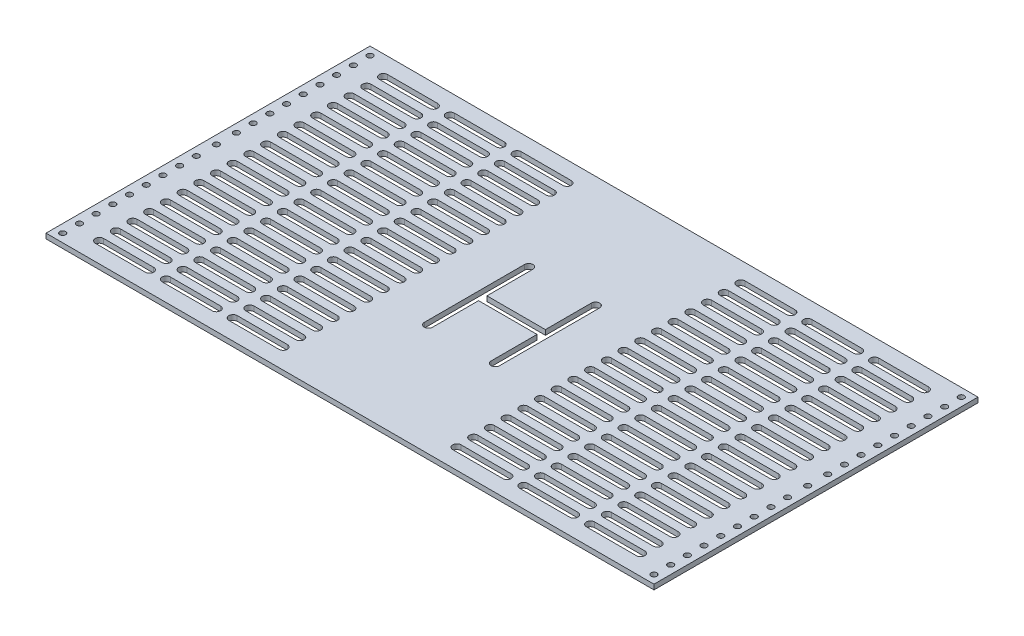
from build123d import *

# Parameters (mm, degrees)
EXTRUDE_1_DEPTH          = 3
CUT_EXTRUDE_1_DEPTH      = 267.024434968
CUT_EXTRUDE_1_DEPTH_BACK = 267.024434968
CUT_EXTRUDE_2_DEPTH      = 267.024434968
MIRROR_2_COPY_1_DEPTH    = 267.024434968
MIRROR_2_COPY_2_DEPTH    = 267.024434968
SKETCH_4_R               = 1.75
CUT_EXTRUDE_3_DEPTH      = 267.024434968
SKETCH_5_R               = 1.75
CUT_EXTRUDE_4_DEPTH      = 267.024434968
MIRROR_4_COPY_1_SKETCH_R = 1.75
MIRROR_4_COPY_1_DEPTH    = 267.024434968


with BuildPart() as part:
    # 草图1 → 凸台-拉伸1 (new body)
    with BuildSketch(Plane(origin=(0, 0, 0), x_dir=(1, 0, 0), z_dir=(0, 1, 0))):
        Polygon((0, 0), (-182, 0), (-182, -194), (182, -194), (182, 0), align=None)
    extrude(amount=EXTRUDE_1_DEPTH)

    # 草图2 → 切除-拉伸1 (cut, two sides: drawn at the far end of the back side and taken through both)
    with BuildSketch(Plane(origin=(0, 3, 0), x_dir=(1, 0, 0), z_dir=(0, 1, 0)).offset(-CUT_EXTRUDE_1_DEPTH_BACK)):
        with BuildLine():
            Line((17.5, -94.5), (-17.5, -94.5))
            Line((-17.5, -94.5), (-17.5, -67))
            ThreePointArc((-17.5, -67), (-20, -64.5), (-22.5, -67))
            Line((-22.5, -67), (-22.5, -127))
            ThreePointArc((-22.5, -127), (-20, -129.5), (-17.5, -127))
            Line((-17.5, -127), (-17.5, -99.5))
            Line((-17.5, -99.5), (17.5, -99.5))
            Line((17.5, -99.5), (17.5, -127))
            ThreePointArc((17.5, -127), (20, -129.5), (22.5, -127))
            Line((22.5, -127), (22.5, -67))
            ThreePointArc((22.5, -67), (20, -64.5), (17.5, -67))
            Line((17.5, -67), (17.5, -94.5))
        make_face()
    extrude(amount=CUT_EXTRUDE_1_DEPTH + CUT_EXTRUDE_1_DEPTH_BACK, mode=Mode.SUBTRACT)

    # 草图3 → 切除-拉伸2 (cut, through all)
    with BuildSketch(Plane(origin=(0, 3, 0), x_dir=(1, 0, 0), z_dir=(0, 1, 0))):
        with BuildLine():
            ThreePointArc((-162, -179.5), (-164.5, -182), (-162, -184.5))
            Line((-162, -184.5), (-132, -184.5))
            ThreePointArc((-132, -184.5), (-129.5, -182), (-132, -179.5))
            Line((-132, -179.5), (-162, -179.5))
        make_face()
        with BuildLine():
            ThreePointArc((-82, -179.5), (-84.5, -182), (-82, -184.5))
            Line((-82, -184.5), (-52, -184.5))
            ThreePointArc((-52, -184.5), (-49.5, -182), (-52, -179.5))
            Line((-52, -179.5), (-82, -179.5))
        make_face()
        with BuildLine():
            ThreePointArc((-122, -179.5), (-124.5, -182), (-122, -184.5))
            Line((-122, -184.5), (-92, -184.5))
            ThreePointArc((-92, -184.5), (-89.5, -182), (-92, -179.5))
            Line((-92, -179.5), (-122, -179.5))
        make_face()
        with BuildLine():
            ThreePointArc((-162, -169.5), (-164.5, -172), (-162, -174.5))
            Line((-162, -174.5), (-132, -174.5))
            ThreePointArc((-132, -174.5), (-129.5, -172), (-132, -169.5))
            Line((-132, -169.5), (-162, -169.5))
        make_face()
        with BuildLine():
            ThreePointArc((-122, -169.5), (-124.5, -172), (-122, -174.5))
            Line((-122, -174.5), (-92, -174.5))
            ThreePointArc((-92, -174.5), (-89.5, -172), (-92, -169.5))
            Line((-92, -169.5), (-122, -169.5))
        make_face()
        with BuildLine():
            ThreePointArc((-82, -169.5), (-84.5, -172), (-82, -174.5))
            Line((-82, -174.5), (-52, -174.5))
            ThreePointArc((-52, -174.5), (-49.5, -172), (-52, -169.5))
            Line((-52, -169.5), (-82, -169.5))
        make_face()
        with BuildLine():
            ThreePointArc((-162, -159.5), (-164.5, -162), (-162, -164.5))
            Line((-162, -164.5), (-132, -164.5))
            ThreePointArc((-132, -164.5), (-129.5, -162), (-132, -159.5))
            Line((-132, -159.5), (-162, -159.5))
        make_face()
        with BuildLine():
            ThreePointArc((-122, -159.5), (-124.5, -162), (-122, -164.5))
            Line((-122, -164.5), (-92, -164.5))
            ThreePointArc((-92, -164.5), (-89.5, -162), (-92, -159.5))
            Line((-92, -159.5), (-122, -159.5))
        make_face()
        with BuildLine():
            ThreePointArc((-82, -159.5), (-84.5, -162), (-82, -164.5))
            Line((-82, -164.5), (-52, -164.5))
            ThreePointArc((-52, -164.5), (-49.5, -162), (-52, -159.5))
            Line((-52, -159.5), (-82, -159.5))
        make_face()
        with BuildLine():
            ThreePointArc((-162, -149.5), (-164.5, -152), (-162, -154.5))
            Line((-162, -154.5), (-132, -154.5))
            ThreePointArc((-132, -154.5), (-129.5, -152), (-132, -149.5))
            Line((-132, -149.5), (-162, -149.5))
        make_face()
        with BuildLine():
            ThreePointArc((-122, -149.5), (-124.5, -152), (-122, -154.5))
            Line((-122, -154.5), (-92, -154.5))
            ThreePointArc((-92, -154.5), (-89.5, -152), (-92, -149.5))
            Line((-92, -149.5), (-122, -149.5))
        make_face()
        with BuildLine():
            ThreePointArc((-82, -149.5), (-84.5, -152), (-82, -154.5))
            Line((-82, -154.5), (-52, -154.5))
            ThreePointArc((-52, -154.5), (-49.5, -152), (-52, -149.5))
            Line((-52, -149.5), (-82, -149.5))
        make_face()
        with BuildLine():
            ThreePointArc((-162, -139.5), (-164.5, -142), (-162, -144.5))
            Line((-162, -144.5), (-132, -144.5))
            ThreePointArc((-132, -144.5), (-129.5, -142), (-132, -139.5))
            Line((-132, -139.5), (-162, -139.5))
        make_face()
        with BuildLine():
            ThreePointArc((-122, -139.5), (-124.5, -142), (-122, -144.5))
            Line((-122, -144.5), (-92, -144.5))
            ThreePointArc((-92, -144.5), (-89.5, -142), (-92, -139.5))
            Line((-92, -139.5), (-122, -139.5))
        make_face()
        with BuildLine():
            ThreePointArc((-82, -139.5), (-84.5, -142), (-82, -144.5))
            Line((-82, -144.5), (-52, -144.5))
            ThreePointArc((-52, -144.5), (-49.5, -142), (-52, -139.5))
            Line((-52, -139.5), (-82, -139.5))
        make_face()
        with BuildLine():
            ThreePointArc((-162, -129.5), (-164.5, -132), (-162, -134.5))
            Line((-162, -134.5), (-132, -134.5))
            ThreePointArc((-132, -134.5), (-129.5, -132), (-132, -129.5))
            Line((-132, -129.5), (-162, -129.5))
        make_face()
        with BuildLine():
            ThreePointArc((-122, -129.5), (-124.5, -132), (-122, -134.5))
            Line((-122, -134.5), (-92, -134.5))
            ThreePointArc((-92, -134.5), (-89.5, -132), (-92, -129.5))
            Line((-92, -129.5), (-122, -129.5))
        make_face()
        with BuildLine():
            ThreePointArc((-82, -129.5), (-84.5, -132), (-82, -134.5))
            Line((-82, -134.5), (-52, -134.5))
            ThreePointArc((-52, -134.5), (-49.5, -132), (-52, -129.5))
            Line((-52, -129.5), (-82, -129.5))
        make_face()
        with BuildLine():
            ThreePointArc((-162, -119.5), (-164.5, -122), (-162, -124.5))
            Line((-162, -124.5), (-132, -124.5))
            ThreePointArc((-132, -124.5), (-129.5, -122), (-132, -119.5))
            Line((-132, -119.5), (-162, -119.5))
        make_face()
        with BuildLine():
            ThreePointArc((-122, -119.5), (-124.5, -122), (-122, -124.5))
            Line((-122, -124.5), (-92, -124.5))
            ThreePointArc((-92, -124.5), (-89.5, -122), (-92, -119.5))
            Line((-92, -119.5), (-122, -119.5))
        make_face()
        with BuildLine():
            ThreePointArc((-82, -119.5), (-84.5, -122), (-82, -124.5))
            Line((-82, -124.5), (-52, -124.5))
            ThreePointArc((-52, -124.5), (-49.5, -122), (-52, -119.5))
            Line((-52, -119.5), (-82, -119.5))
        make_face()
        with BuildLine():
            ThreePointArc((-162, -109.5), (-164.5, -112), (-162, -114.5))
            Line((-162, -114.5), (-132, -114.5))
            ThreePointArc((-132, -114.5), (-129.5, -112), (-132, -109.5))
            Line((-132, -109.5), (-162, -109.5))
        make_face()
        with BuildLine():
            ThreePointArc((-122, -109.5), (-124.5, -112), (-122, -114.5))
            Line((-122, -114.5), (-92, -114.5))
            ThreePointArc((-92, -114.5), (-89.5, -112), (-92, -109.5))
            Line((-92, -109.5), (-122, -109.5))
        make_face()
        with BuildLine():
            ThreePointArc((-82, -109.5), (-84.5, -112), (-82, -114.5))
            Line((-82, -114.5), (-52, -114.5))
            ThreePointArc((-52, -114.5), (-49.5, -112), (-52, -109.5))
            Line((-52, -109.5), (-82, -109.5))
        make_face()
        with BuildLine():
            ThreePointArc((-162, -99.5), (-164.5, -102), (-162, -104.5))
            Line((-162, -104.5), (-132, -104.5))
            ThreePointArc((-132, -104.5), (-129.5, -102), (-132, -99.5))
            Line((-132, -99.5), (-162, -99.5))
        make_face()
        with BuildLine():
            ThreePointArc((-122, -99.5), (-124.5, -102), (-122, -104.5))
            Line((-122, -104.5), (-92, -104.5))
            ThreePointArc((-92, -104.5), (-89.5, -102), (-92, -99.5))
            Line((-92, -99.5), (-122, -99.5))
        make_face()
        with BuildLine():
            ThreePointArc((-82, -99.5), (-84.5, -102), (-82, -104.5))
            Line((-82, -104.5), (-52, -104.5))
            ThreePointArc((-52, -104.5), (-49.5, -102), (-52, -99.5))
            Line((-52, -99.5), (-82, -99.5))
        make_face()
    cut_extrude_2 = extrude(amount=-CUT_EXTRUDE_2_DEPTH, mode=Mode.SUBTRACT)

    # 镜向1: 切除-拉伸2 across plane
    add(cut_extrude_2.mirror(Plane.XY.offset(97)), mode=Mode.SUBTRACT)

    # 镜向2 copy 1 sketch → 镜向2 copy 1 (cut, through all)
    with BuildSketch(Plane(origin=(0, 3, 194), x_dir=(-1, 0, 0), z_dir=(0, 1, 0))):
        with BuildLine():
            ThreePointArc((-162, -179.5), (-164.5, -182), (-162, -184.5))
            Line((-162, -184.5), (-132, -184.5))
            ThreePointArc((-132, -184.5), (-129.5, -182), (-132, -179.5))
            Line((-132, -179.5), (-162, -179.5))
        make_face()
        with BuildLine():
            ThreePointArc((-82, -179.5), (-84.5, -182), (-82, -184.5))
            Line((-82, -184.5), (-52, -184.5))
            ThreePointArc((-52, -184.5), (-49.5, -182), (-52, -179.5))
            Line((-52, -179.5), (-82, -179.5))
        make_face()
        with BuildLine():
            ThreePointArc((-122, -179.5), (-124.5, -182), (-122, -184.5))
            Line((-122, -184.5), (-92, -184.5))
            ThreePointArc((-92, -184.5), (-89.5, -182), (-92, -179.5))
            Line((-92, -179.5), (-122, -179.5))
        make_face()
        with BuildLine():
            ThreePointArc((-162, -169.5), (-164.5, -172), (-162, -174.5))
            Line((-162, -174.5), (-132, -174.5))
            ThreePointArc((-132, -174.5), (-129.5, -172), (-132, -169.5))
            Line((-132, -169.5), (-162, -169.5))
        make_face()
        with BuildLine():
            ThreePointArc((-122, -169.5), (-124.5, -172), (-122, -174.5))
            Line((-122, -174.5), (-92, -174.5))
            ThreePointArc((-92, -174.5), (-89.5, -172), (-92, -169.5))
            Line((-92, -169.5), (-122, -169.5))
        make_face()
        with BuildLine():
            ThreePointArc((-82, -169.5), (-84.5, -172), (-82, -174.5))
            Line((-82, -174.5), (-52, -174.5))
            ThreePointArc((-52, -174.5), (-49.5, -172), (-52, -169.5))
            Line((-52, -169.5), (-82, -169.5))
        make_face()
        with BuildLine():
            ThreePointArc((-162, -159.5), (-164.5, -162), (-162, -164.5))
            Line((-162, -164.5), (-132, -164.5))
            ThreePointArc((-132, -164.5), (-129.5, -162), (-132, -159.5))
            Line((-132, -159.5), (-162, -159.5))
        make_face()
        with BuildLine():
            ThreePointArc((-122, -159.5), (-124.5, -162), (-122, -164.5))
            Line((-122, -164.5), (-92, -164.5))
            ThreePointArc((-92, -164.5), (-89.5, -162), (-92, -159.5))
            Line((-92, -159.5), (-122, -159.5))
        make_face()
        with BuildLine():
            ThreePointArc((-82, -159.5), (-84.5, -162), (-82, -164.5))
            Line((-82, -164.5), (-52, -164.5))
            ThreePointArc((-52, -164.5), (-49.5, -162), (-52, -159.5))
            Line((-52, -159.5), (-82, -159.5))
        make_face()
        with BuildLine():
            ThreePointArc((-162, -149.5), (-164.5, -152), (-162, -154.5))
            Line((-162, -154.5), (-132, -154.5))
            ThreePointArc((-132, -154.5), (-129.5, -152), (-132, -149.5))
            Line((-132, -149.5), (-162, -149.5))
        make_face()
        with BuildLine():
            ThreePointArc((-122, -149.5), (-124.5, -152), (-122, -154.5))
            Line((-122, -154.5), (-92, -154.5))
            ThreePointArc((-92, -154.5), (-89.5, -152), (-92, -149.5))
            Line((-92, -149.5), (-122, -149.5))
        make_face()
        with BuildLine():
            ThreePointArc((-82, -149.5), (-84.5, -152), (-82, -154.5))
            Line((-82, -154.5), (-52, -154.5))
            ThreePointArc((-52, -154.5), (-49.5, -152), (-52, -149.5))
            Line((-52, -149.5), (-82, -149.5))
        make_face()
        with BuildLine():
            ThreePointArc((-162, -139.5), (-164.5, -142), (-162, -144.5))
            Line((-162, -144.5), (-132, -144.5))
            ThreePointArc((-132, -144.5), (-129.5, -142), (-132, -139.5))
            Line((-132, -139.5), (-162, -139.5))
        make_face()
        with BuildLine():
            ThreePointArc((-122, -139.5), (-124.5, -142), (-122, -144.5))
            Line((-122, -144.5), (-92, -144.5))
            ThreePointArc((-92, -144.5), (-89.5, -142), (-92, -139.5))
            Line((-92, -139.5), (-122, -139.5))
        make_face()
        with BuildLine():
            ThreePointArc((-82, -139.5), (-84.5, -142), (-82, -144.5))
            Line((-82, -144.5), (-52, -144.5))
            ThreePointArc((-52, -144.5), (-49.5, -142), (-52, -139.5))
            Line((-52, -139.5), (-82, -139.5))
        make_face()
        with BuildLine():
            ThreePointArc((-162, -129.5), (-164.5, -132), (-162, -134.5))
            Line((-162, -134.5), (-132, -134.5))
            ThreePointArc((-132, -134.5), (-129.5, -132), (-132, -129.5))
            Line((-132, -129.5), (-162, -129.5))
        make_face()
        with BuildLine():
            ThreePointArc((-122, -129.5), (-124.5, -132), (-122, -134.5))
            Line((-122, -134.5), (-92, -134.5))
            ThreePointArc((-92, -134.5), (-89.5, -132), (-92, -129.5))
            Line((-92, -129.5), (-122, -129.5))
        make_face()
        with BuildLine():
            ThreePointArc((-82, -129.5), (-84.5, -132), (-82, -134.5))
            Line((-82, -134.5), (-52, -134.5))
            ThreePointArc((-52, -134.5), (-49.5, -132), (-52, -129.5))
            Line((-52, -129.5), (-82, -129.5))
        make_face()
        with BuildLine():
            ThreePointArc((-162, -119.5), (-164.5, -122), (-162, -124.5))
            Line((-162, -124.5), (-132, -124.5))
            ThreePointArc((-132, -124.5), (-129.5, -122), (-132, -119.5))
            Line((-132, -119.5), (-162, -119.5))
        make_face()
        with BuildLine():
            ThreePointArc((-122, -119.5), (-124.5, -122), (-122, -124.5))
            Line((-122, -124.5), (-92, -124.5))
            ThreePointArc((-92, -124.5), (-89.5, -122), (-92, -119.5))
            Line((-92, -119.5), (-122, -119.5))
        make_face()
        with BuildLine():
            ThreePointArc((-82, -119.5), (-84.5, -122), (-82, -124.5))
            Line((-82, -124.5), (-52, -124.5))
            ThreePointArc((-52, -124.5), (-49.5, -122), (-52, -119.5))
            Line((-52, -119.5), (-82, -119.5))
        make_face()
        with BuildLine():
            ThreePointArc((-162, -109.5), (-164.5, -112), (-162, -114.5))
            Line((-162, -114.5), (-132, -114.5))
            ThreePointArc((-132, -114.5), (-129.5, -112), (-132, -109.5))
            Line((-132, -109.5), (-162, -109.5))
        make_face()
        with BuildLine():
            ThreePointArc((-122, -109.5), (-124.5, -112), (-122, -114.5))
            Line((-122, -114.5), (-92, -114.5))
            ThreePointArc((-92, -114.5), (-89.5, -112), (-92, -109.5))
            Line((-92, -109.5), (-122, -109.5))
        make_face()
        with BuildLine():
            ThreePointArc((-82, -109.5), (-84.5, -112), (-82, -114.5))
            Line((-82, -114.5), (-52, -114.5))
            ThreePointArc((-52, -114.5), (-49.5, -112), (-52, -109.5))
            Line((-52, -109.5), (-82, -109.5))
        make_face()
        with BuildLine():
            ThreePointArc((-162, -99.5), (-164.5, -102), (-162, -104.5))
            Line((-162, -104.5), (-132, -104.5))
            ThreePointArc((-132, -104.5), (-129.5, -102), (-132, -99.5))
            Line((-132, -99.5), (-162, -99.5))
        make_face()
        with BuildLine():
            ThreePointArc((-122, -99.5), (-124.5, -102), (-122, -104.5))
            Line((-122, -104.5), (-92, -104.5))
            ThreePointArc((-92, -104.5), (-89.5, -102), (-92, -99.5))
            Line((-92, -99.5), (-122, -99.5))
        make_face()
        with BuildLine():
            ThreePointArc((-82, -99.5), (-84.5, -102), (-82, -104.5))
            Line((-82, -104.5), (-52, -104.5))
            ThreePointArc((-52, -104.5), (-49.5, -102), (-52, -99.5))
            Line((-52, -99.5), (-82, -99.5))
        make_face()
    extrude(amount=-MIRROR_2_COPY_1_DEPTH, mode=Mode.SUBTRACT)

    # 镜向2 copy 2 sketch → 镜向2 copy 2 (cut, through all)
    with BuildSketch(Plane(origin=(0, 3, 0), x_dir=(-1, 0, 0), z_dir=(0, 1, 0))):
        with BuildLine():
            ThreePointArc((-162, 179.5), (-164.5, 182), (-162, 184.5))
            Line((-162, 184.5), (-132, 184.5))
            ThreePointArc((-132, 184.5), (-129.5, 182), (-132, 179.5))
            Line((-132, 179.5), (-162, 179.5))
        make_face()
        with BuildLine():
            ThreePointArc((-82, 179.5), (-84.5, 182), (-82, 184.5))
            Line((-82, 184.5), (-52, 184.5))
            ThreePointArc((-52, 184.5), (-49.5, 182), (-52, 179.5))
            Line((-52, 179.5), (-82, 179.5))
        make_face()
        with BuildLine():
            ThreePointArc((-122, 179.5), (-124.5, 182), (-122, 184.5))
            Line((-122, 184.5), (-92, 184.5))
            ThreePointArc((-92, 184.5), (-89.5, 182), (-92, 179.5))
            Line((-92, 179.5), (-122, 179.5))
        make_face()
        with BuildLine():
            ThreePointArc((-162, 169.5), (-164.5, 172), (-162, 174.5))
            Line((-162, 174.5), (-132, 174.5))
            ThreePointArc((-132, 174.5), (-129.5, 172), (-132, 169.5))
            Line((-132, 169.5), (-162, 169.5))
        make_face()
        with BuildLine():
            ThreePointArc((-122, 169.5), (-124.5, 172), (-122, 174.5))
            Line((-122, 174.5), (-92, 174.5))
            ThreePointArc((-92, 174.5), (-89.5, 172), (-92, 169.5))
            Line((-92, 169.5), (-122, 169.5))
        make_face()
        with BuildLine():
            ThreePointArc((-82, 169.5), (-84.5, 172), (-82, 174.5))
            Line((-82, 174.5), (-52, 174.5))
            ThreePointArc((-52, 174.5), (-49.5, 172), (-52, 169.5))
            Line((-52, 169.5), (-82, 169.5))
        make_face()
        with BuildLine():
            ThreePointArc((-162, 159.5), (-164.5, 162), (-162, 164.5))
            Line((-162, 164.5), (-132, 164.5))
            ThreePointArc((-132, 164.5), (-129.5, 162), (-132, 159.5))
            Line((-132, 159.5), (-162, 159.5))
        make_face()
        with BuildLine():
            ThreePointArc((-122, 159.5), (-124.5, 162), (-122, 164.5))
            Line((-122, 164.5), (-92, 164.5))
            ThreePointArc((-92, 164.5), (-89.5, 162), (-92, 159.5))
            Line((-92, 159.5), (-122, 159.5))
        make_face()
        with BuildLine():
            ThreePointArc((-82, 159.5), (-84.5, 162), (-82, 164.5))
            Line((-82, 164.5), (-52, 164.5))
            ThreePointArc((-52, 164.5), (-49.5, 162), (-52, 159.5))
            Line((-52, 159.5), (-82, 159.5))
        make_face()
        with BuildLine():
            ThreePointArc((-162, 149.5), (-164.5, 152), (-162, 154.5))
            Line((-162, 154.5), (-132, 154.5))
            ThreePointArc((-132, 154.5), (-129.5, 152), (-132, 149.5))
            Line((-132, 149.5), (-162, 149.5))
        make_face()
        with BuildLine():
            ThreePointArc((-122, 149.5), (-124.5, 152), (-122, 154.5))
            Line((-122, 154.5), (-92, 154.5))
            ThreePointArc((-92, 154.5), (-89.5, 152), (-92, 149.5))
            Line((-92, 149.5), (-122, 149.5))
        make_face()
        with BuildLine():
            ThreePointArc((-82, 149.5), (-84.5, 152), (-82, 154.5))
            Line((-82, 154.5), (-52, 154.5))
            ThreePointArc((-52, 154.5), (-49.5, 152), (-52, 149.5))
            Line((-52, 149.5), (-82, 149.5))
        make_face()
        with BuildLine():
            ThreePointArc((-162, 139.5), (-164.5, 142), (-162, 144.5))
            Line((-162, 144.5), (-132, 144.5))
            ThreePointArc((-132, 144.5), (-129.5, 142), (-132, 139.5))
            Line((-132, 139.5), (-162, 139.5))
        make_face()
        with BuildLine():
            ThreePointArc((-122, 139.5), (-124.5, 142), (-122, 144.5))
            Line((-122, 144.5), (-92, 144.5))
            ThreePointArc((-92, 144.5), (-89.5, 142), (-92, 139.5))
            Line((-92, 139.5), (-122, 139.5))
        make_face()
        with BuildLine():
            ThreePointArc((-82, 139.5), (-84.5, 142), (-82, 144.5))
            Line((-82, 144.5), (-52, 144.5))
            ThreePointArc((-52, 144.5), (-49.5, 142), (-52, 139.5))
            Line((-52, 139.5), (-82, 139.5))
        make_face()
        with BuildLine():
            ThreePointArc((-162, 129.5), (-164.5, 132), (-162, 134.5))
            Line((-162, 134.5), (-132, 134.5))
            ThreePointArc((-132, 134.5), (-129.5, 132), (-132, 129.5))
            Line((-132, 129.5), (-162, 129.5))
        make_face()
        with BuildLine():
            ThreePointArc((-122, 129.5), (-124.5, 132), (-122, 134.5))
            Line((-122, 134.5), (-92, 134.5))
            ThreePointArc((-92, 134.5), (-89.5, 132), (-92, 129.5))
            Line((-92, 129.5), (-122, 129.5))
        make_face()
        with BuildLine():
            ThreePointArc((-82, 129.5), (-84.5, 132), (-82, 134.5))
            Line((-82, 134.5), (-52, 134.5))
            ThreePointArc((-52, 134.5), (-49.5, 132), (-52, 129.5))
            Line((-52, 129.5), (-82, 129.5))
        make_face()
        with BuildLine():
            ThreePointArc((-162, 119.5), (-164.5, 122), (-162, 124.5))
            Line((-162, 124.5), (-132, 124.5))
            ThreePointArc((-132, 124.5), (-129.5, 122), (-132, 119.5))
            Line((-132, 119.5), (-162, 119.5))
        make_face()
        with BuildLine():
            ThreePointArc((-122, 119.5), (-124.5, 122), (-122, 124.5))
            Line((-122, 124.5), (-92, 124.5))
            ThreePointArc((-92, 124.5), (-89.5, 122), (-92, 119.5))
            Line((-92, 119.5), (-122, 119.5))
        make_face()
        with BuildLine():
            ThreePointArc((-82, 119.5), (-84.5, 122), (-82, 124.5))
            Line((-82, 124.5), (-52, 124.5))
            ThreePointArc((-52, 124.5), (-49.5, 122), (-52, 119.5))
            Line((-52, 119.5), (-82, 119.5))
        make_face()
        with BuildLine():
            ThreePointArc((-162, 109.5), (-164.5, 112), (-162, 114.5))
            Line((-162, 114.5), (-132, 114.5))
            ThreePointArc((-132, 114.5), (-129.5, 112), (-132, 109.5))
            Line((-132, 109.5), (-162, 109.5))
        make_face()
        with BuildLine():
            ThreePointArc((-122, 109.5), (-124.5, 112), (-122, 114.5))
            Line((-122, 114.5), (-92, 114.5))
            ThreePointArc((-92, 114.5), (-89.5, 112), (-92, 109.5))
            Line((-92, 109.5), (-122, 109.5))
        make_face()
        with BuildLine():
            ThreePointArc((-82, 109.5), (-84.5, 112), (-82, 114.5))
            Line((-82, 114.5), (-52, 114.5))
            ThreePointArc((-52, 114.5), (-49.5, 112), (-52, 109.5))
            Line((-52, 109.5), (-82, 109.5))
        make_face()
        with BuildLine():
            ThreePointArc((-162, 99.5), (-164.5, 102), (-162, 104.5))
            Line((-162, 104.5), (-132, 104.5))
            ThreePointArc((-132, 104.5), (-129.5, 102), (-132, 99.5))
            Line((-132, 99.5), (-162, 99.5))
        make_face()
        with BuildLine():
            ThreePointArc((-122, 99.5), (-124.5, 102), (-122, 104.5))
            Line((-122, 104.5), (-92, 104.5))
            ThreePointArc((-92, 104.5), (-89.5, 102), (-92, 99.5))
            Line((-92, 99.5), (-122, 99.5))
        make_face()
        with BuildLine():
            ThreePointArc((-82, 99.5), (-84.5, 102), (-82, 104.5))
            Line((-82, 104.5), (-52, 104.5))
            ThreePointArc((-52, 104.5), (-49.5, 102), (-52, 99.5))
            Line((-52, 99.5), (-82, 99.5))
        make_face()
    extrude(amount=-MIRROR_2_COPY_2_DEPTH, mode=Mode.SUBTRACT)

    # 草图4 → 切除-拉伸3 (cut, through all)
    with BuildSketch(Plane(origin=(0, 3, 0), x_dir=(1, 0, 0), z_dir=(0, 1, 0))):
        with Locations((-177, -189)):
            Circle(SKETCH_4_R)
        with Locations((-177, -179)):
            Circle(SKETCH_4_R)
        with Locations((-177, -169)):
            Circle(SKETCH_4_R)
        with Locations((-177, -159)):
            Circle(SKETCH_4_R)
        with Locations((-177, -149)):
            Circle(SKETCH_4_R)
        with Locations((-177, -139)):
            Circle(SKETCH_4_R)
        with Locations((-177, -129)):
            Circle(SKETCH_4_R)
        with Locations((-177, -119)):
            Circle(SKETCH_4_R)
        with Locations((-177, -109)):
            Circle(SKETCH_4_R)
    cut_extrude_3 = extrude(amount=-CUT_EXTRUDE_3_DEPTH, mode=Mode.SUBTRACT)

    # 镜向3: 切除-拉伸3 across plane
    add(cut_extrude_3.mirror(Plane.XY.offset(97)), mode=Mode.SUBTRACT)

    # 草图5 → 切除-拉伸4 (cut, through all)
    with BuildSketch(Plane(origin=(0, 3, 0), x_dir=(1, 0, 0), z_dir=(0, 1, 0))):
        with Locations((-177, -97)):
            Circle(SKETCH_5_R)
    cut_extrude_4 = extrude(amount=-CUT_EXTRUDE_4_DEPTH, mode=Mode.SUBTRACT)

    # 镜向4: 切除-拉伸3, 切除-拉伸4 across plane
    add(cut_extrude_3.mirror(Plane(origin=(0, 0, 0), x_dir=(0, 0, 1), z_dir=(1, 0, 0))), mode=Mode.SUBTRACT)
    add(cut_extrude_4.mirror(Plane(origin=(0, 0, 0), x_dir=(0, 0, 1), z_dir=(1, 0, 0))), mode=Mode.SUBTRACT)

    # 镜向4 copy 1 sketch → 镜向4 copy 1 (cut, through all)
    with BuildSketch(Plane(origin=(0, 3, 194), x_dir=(-1, 0, 0), z_dir=(0, 1, 0))):
        with Locations((-177, -189)):
            Circle(MIRROR_4_COPY_1_SKETCH_R)
        with Locations((-177, -179)):
            Circle(MIRROR_4_COPY_1_SKETCH_R)
        with Locations((-177, -169)):
            Circle(MIRROR_4_COPY_1_SKETCH_R)
        with Locations((-177, -159)):
            Circle(MIRROR_4_COPY_1_SKETCH_R)
        with Locations((-177, -149)):
            Circle(MIRROR_4_COPY_1_SKETCH_R)
        with Locations((-177, -139)):
            Circle(MIRROR_4_COPY_1_SKETCH_R)
        with Locations((-177, -129)):
            Circle(MIRROR_4_COPY_1_SKETCH_R)
        with Locations((-177, -119)):
            Circle(MIRROR_4_COPY_1_SKETCH_R)
        with Locations((-177, -109)):
            Circle(MIRROR_4_COPY_1_SKETCH_R)
    extrude(amount=-MIRROR_4_COPY_1_DEPTH, mode=Mode.SUBTRACT)


solid = part.part
